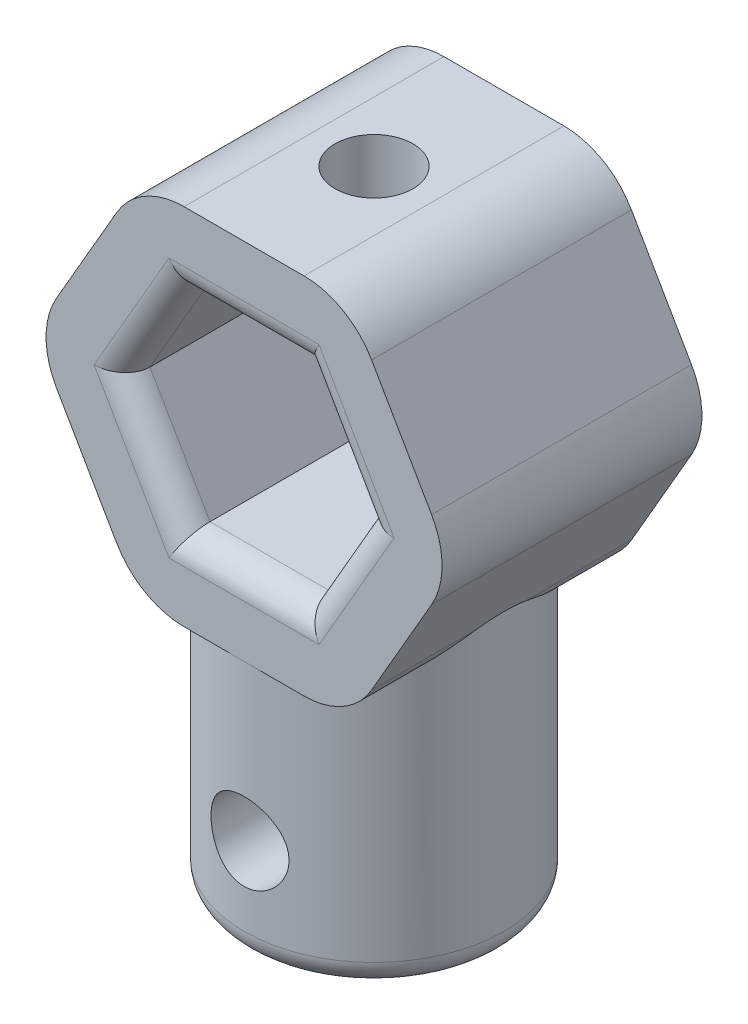
from build123d import *

# Parameters (mm, degrees)
ESBO_O1_R                = 5
ESBO_O1_R_2              = 2.3
RESSALTO_EXTRUS_O1_DEPTH = 12
ESBO_O2_R                = 1.5
CORTE_EXTRUS_O1_DEPTH    = 10
RESSALTO_EXTRUS_O2_DEPTH = 5
ESBO_O4_R                = 1.5
CORTE_EXTRUS_O2_DEPTH    = 5
FILETE1_R                = 1
FILETE2_R                = 3


with BuildPart() as part:
    # Esboço1 → Ressalto-extrusão1 (new body)
    with BuildSketch(Plane(origin=(0, 0, 0), x_dir=(1, 0, 0), z_dir=(0, 1, 0))):
        with Locations(Location((0, 0, 0), (0, 0, 270))):
            Circle(ESBO_O1_R)
        with Locations(Location((0, 0, 0), (0, 0, 270))):
            Circle(ESBO_O1_R_2, mode=Mode.SUBTRACT)
    extrude(amount=RESSALTO_EXTRUS_O1_DEPTH)

    # Esboço2 → Corte-extrusão1 (cut)
    with BuildSketch(Plane.XY):
        with Locations(Location((0, 4, 0), (0, 0, 180))):
            Circle(ESBO_O2_R)
    extrude(amount=CORTE_EXTRUS_O1_DEPTH, mode=Mode.SUBTRACT)

    # Esboço3 → Ressalto-extrusão2 (add, symmetric)
    with BuildSketch(Plane.XY):
        Polygon((4.041451884, 10), (8.082903769, 17), (4.041451884, 24), (-4.041451884, 24), (-8.082903769, 17), (-4.041451884, 10), align=None)
        Polygon((2.309401077, 13), (4.618802154, 17), (2.309401077, 21), (-2.309401077, 21), (-4.618802154, 17), (-2.309401077, 13), align=None, mode=Mode.SUBTRACT)
    extrude(amount=RESSALTO_EXTRUS_O2_DEPTH, both=True)

    # Esboço4 → Corte-extrusão2 (cut)
    with BuildSketch(Plane(origin=(0, 24, 0), x_dir=(1, 0, 0), z_dir=(0, 1, 0))):
        with Locations(Location((0, 0, 0), (0, 0, 270))):
            Circle(ESBO_O4_R)
    extrude(amount=-CORTE_EXTRUS_O2_DEPTH, mode=Mode.SUBTRACT)

    # Filete1
    filete1_edges = [part.edges().sort_by_distance(p)[0] for p in [
        (0, 0, -5),
        (0, 13, -5),
        (3.464101615, 15, -5),
        (3.464101615, 19, -5),
        (0, 21, -5),
        (-3.464101615, 19, -5),
        (-3.464101615, 15, -5),
        (0, 13, 5),
        (3.464101615, 15, 5),
        (3.464101615, 19, 5),
        (0, 21, 5),
        (-3.464101615, 19, 5),
        (-3.464101615, 15, 5),
        (0, 0, -2.3),
    ]]
    fillet(filete1_edges, radius=FILETE1_R - 0.0001)  # a hair under: the kernel refuses the full size

    # Filete2
    filete2_edges = [part.edges().sort_by_distance(p)[0] for p in [
        (-4.041451884, 10, -3.971960144),
        (-4.041451884, 10, 3.971960144),
        (8.082903769, 17, 0),
        (4.041451884, 10, 3.971960144),
        (4.041451884, 10, -3.971960144),
        (4.041451884, 24, 0),
        (-4.041451884, 24, 0),
        (-8.082903769, 17, 0),
    ]]
    fillet(filete2_edges, radius=FILETE2_R)


solid = part.part
